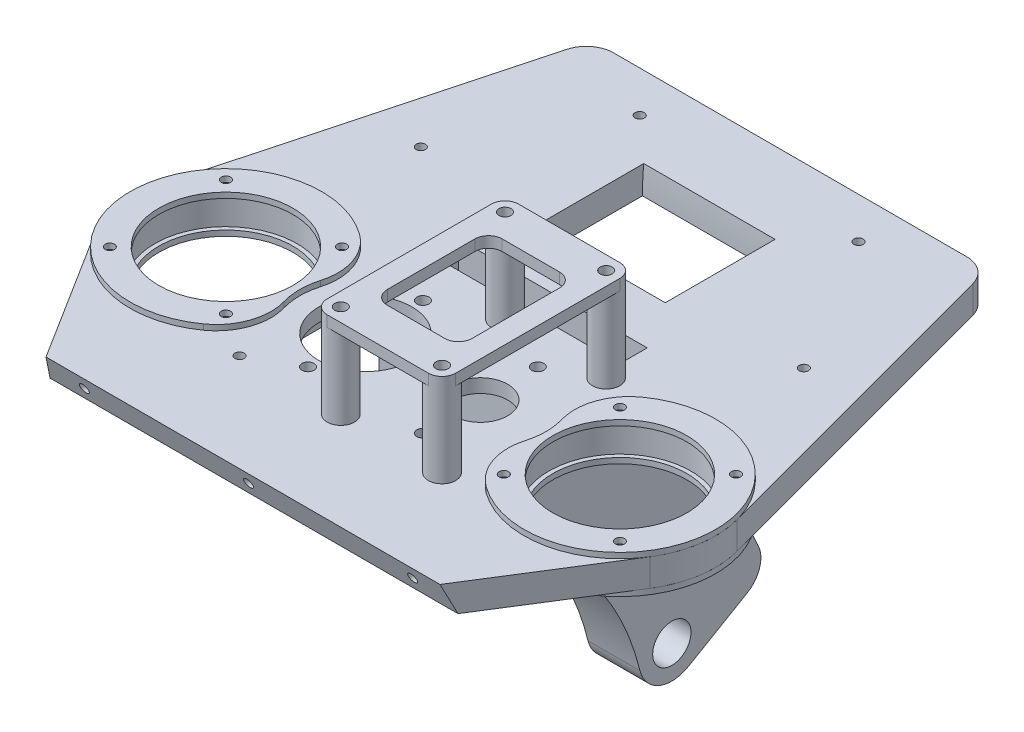
from build123d import *

# Parameters (mm, degrees)
EXTRUDE_1_DEPTH          = 2.5
EXTRUDE_1_DEPTH_BACK     = 2.5
SKETCH_1_R               = 13
SKETCH_1_R_2             = 1.1
SKETCH_1_R_3             = 5
SKETCH_1_R_4             = 8.5
SKETCH_1_R_5             = 0.85
SKETCH_2_R               = 1.1
SKETCH_2_R_2             = 12.25
EXTRUDE_2_DEPTH          = 1
MIRROR_START             = -3.5
MIRROR_1_OUTLINE_R       = 1.1
MIRROR_1_OUTLINE_R_2     = 12.25
MIRROR_1_DEPTH           = 1
MIRROR_START_2           = 2.5
MIRROR_1_2_OUTLINE_R     = 1.1
MIRROR_1_2_OUTLINE_R_2   = 12.25
MIRROR_1_2_DEPTH         = 1
EXTRUDE_START            = -1
SKETCH_38_R              = 1.1
SKETCH_38_R_2            = 0.85
EXTRUDE_10_DEPTH         = 1
SKETCH_3_W               = 36
SKETCH_3_H               = 26
CUT_EXTRUDE_1_DEPTH      = 2.5
SKETCH_6_R               = 1.1
EXTRUDE_3_DEPTH          = 2
SKETCH_16_R              = 3.5
EXTRUDE_6_DEPTH          = 6
EXTRUDE_7_DEPTH          = 33.5
EXTRUDE_7_DEPTH_BACK     = 3
SKETCH_17_R              = 3.5
CUT_EXTRUDE_7_DEPTH      = 12
CUT_EXTRUDE_7_DEPTH_BACK = 12
SKETCH_24_R              = 22.5
CUT_EXTRUDE_8_REACH      = 83.241
CUT_EXTRUDE_8_END_RADIUS = 22.5
SKETCH_25_W              = 34.5
SKETCH_25_H              = 5
CUT_EXTRUDE_9_DEPTH      = 4
CUT_EXTRUDE_9_DEPTH_BACK = 4
SKETCH_26_R              = 77.5
EXTRUDE_8_DEPTH          = 5
SKETCH_28_R              = 72.5
SKETCH_28_R_2            = 52.5
CUT_EXTRUDE_10_DEPTH     = 24
CUT_EXTRUDE_11_DEPTH     = 10
SKETCH_30_R              = 0.85
CUT_EXTRUDE_12_DEPTH     = 10
FILLET_1_R               = 5
SKETCH_31_R              = 0.85
CUT_EXTRUDE_13_DEPTH     = 100.843329311
SKETCH_32_R              = 0.85
CUT_EXTRUDE_14_DEPTH     = 100.843329311
SKETCH_33_W              = 34.5
SKETCH_33_H              = 5
CUT_EXTRUDE_15_DEPTH     = 98.384241066
EXTRUDE_START_2          = -5
EXTRUDE_9_DEPTH          = 5
CUT_EXTRUDE_16_DEPTH     = 133.551651849
CUT_EXTRUDE_START        = -10
SKETCH_36_R              = 0.85
CUT_EXTRUDE_17_DEPTH     = 10
SKETCH_39_R              = 2.5
SKETCH_39_R_2            = 1.1
EXTRUDE_11_DEPTH         = 15
EXTRUDE_11_2_DEPTH       = 15
EXTRUDE_11_3_DEPTH       = 15
EXTRUDE_11_4_DEPTH       = 15
CUT_EXTRUDE_18_DEPTH     = 2


# Read off the part's stored shape, not the designer's step: ﾐﾗｰ1
with BuildPart() as part:
    # ｽｹｯﾁ1 → ﾎﾞｽ - 押し出し1 (new, two sides: drawn at the far end of the back side and taken through both)
    with BuildSketch(Plane(origin=(0, 0, 0), x_dir=(1, 0, 0), z_dir=(0, 1, 0)).offset(-EXTRUDE_1_DEPTH_BACK)):
        with BuildLine():
            Line((-36, 17.5), (36, 17.5))
            ThreePointArc((36, 17.5), (53.5, 0), (36, -17.5))
            Line((36, -17.5), (-36, -17.5))
            ThreePointArc((-36, -17.5), (-53.5, 0), (-36, 17.5))
        make_face()
        with Locations(Location((-36, 0, 0), (0, 0, 270))):
            Circle(SKETCH_1_R, mode=Mode.SUBTRACT)
        with Locations(Location((36, 0, 0), (0, 0, 270))):
            Circle(SKETCH_1_R, mode=Mode.SUBTRACT)
        with Locations(Location((-46.606601718, 10.606601718, 0), (0, 0, 270))):
            Circle(SKETCH_1_R_2, mode=Mode.SUBTRACT)
        with Locations(Location((-25.393398282, 10.606601718, 0), (0, 0, 270))):
            Circle(SKETCH_1_R_2, mode=Mode.SUBTRACT)
        with Locations(Location((-25.393398282, -10.606601718, 0), (0, 0, 270))):
            Circle(SKETCH_1_R_2, mode=Mode.SUBTRACT)
        with Locations(Location((-46.606601718, -10.606601718, 0), (0, 0, 270))):
            Circle(SKETCH_1_R_2, mode=Mode.SUBTRACT)
        with Locations(Location((46.606601718, 10.606601718, 0), (0, 0, 90))):
            Circle(SKETCH_1_R_2, mode=Mode.SUBTRACT)
        with Locations(Location((46.606601718, -10.606601718, 0), (0, 0, 90))):
            Circle(SKETCH_1_R_2, mode=Mode.SUBTRACT)
        with Locations(Location((25.393398282, -10.606601718, 0), (0, 0, 90))):
            Circle(SKETCH_1_R_2, mode=Mode.SUBTRACT)
        with Locations(Location((25.393398282, 10.606601718, 0), (0, 0, 90))):
            Circle(SKETCH_1_R_2, mode=Mode.SUBTRACT)
        with Locations(Location((-10.5, 10.5, 0), (0, 0, 270))):
            Circle(SKETCH_1_R_2, mode=Mode.SUBTRACT)
        with Locations(Location((-10.5, -10.5, 0), (0, 0, 90))):
            Circle(SKETCH_1_R_2, mode=Mode.SUBTRACT)
        with Locations(Location((10.5, -10.5, 0), (0, 0, 270))):
            Circle(SKETCH_1_R_2, mode=Mode.SUBTRACT)
        with Locations(Location((10.5, 10.5, 0), (0, 0, 90))):
            Circle(SKETCH_1_R_2, mode=Mode.SUBTRACT)
        with Locations(Location((10.5, 0, 0), (0, 0, 270))):
            Circle(SKETCH_1_R_3, mode=Mode.SUBTRACT)
        with Locations(Location((-10.5, 0, 0), (0, 0, 270))):
            Circle(SKETCH_1_R_4, mode=Mode.SUBTRACT)
        with Locations(Location((0, 15, 0), (0, 0, 270))):
            Circle(SKETCH_1_R_5, mode=Mode.SUBTRACT)
        with Locations(Location((0, -15, 0), (0, 0, 90))):
            Circle(SKETCH_1_R_5, mode=Mode.SUBTRACT)
        with Locations(Location((18.5, -15, 0), (0, 0, 270))):
            Circle(SKETCH_1_R_5, mode=Mode.SUBTRACT)
        with Locations(Location((18.5, 15, 0), (0, 0, 90))):
            Circle(SKETCH_1_R_5, mode=Mode.SUBTRACT)
        with Locations(Location((-18.5, -15, 0), (0, 0, 90))):
            Circle(SKETCH_1_R_5, mode=Mode.SUBTRACT)
        with Locations(Location((-18.5, 15, 0), (0, 0, 270))):
            Circle(SKETCH_1_R_5, mode=Mode.SUBTRACT)
    extrude(amount=EXTRUDE_1_DEPTH + EXTRUDE_1_DEPTH_BACK)

    # ｽｹｯﾁ3 → ｶｯﾄ - 押し出し1 (cut)
    with BuildSketch(Plane.XZ.offset(2.5)):
        with Locations((-2.5, 0)):
            Rectangle(SKETCH_3_W, SKETCH_3_H)
    extrude(amount=-CUT_EXTRUDE_1_DEPTH, mode=Mode.SUBTRACT)


with BuildPart() as body_2:
    # ｽｹｯﾁ2 → ﾎﾞｽ - 押し出し2 (new body)
    with BuildSketch(Plane(origin=(0, 2.5, 0), x_dir=(1, 0, 0), z_dir=(0, 1, 0))):
        with BuildLine():
            ThreePointArc((-25.820261438, 14.234567883), (-53.5, 0), (-25.820261438, -14.234567883))
            ThreePointArc((-25.820261438, -14.234567883), (-22.191510142, -9.383501212), (-22.029411765, -3.327561323))
            ThreePointArc((-22.029411765, -3.327561323), (-22.5, 0), (-22.029411765, 3.327561323))
            ThreePointArc((-22.029411765, 3.327561323), (-22.191510142, 9.383501212), (-25.820261438, 14.234567883))
        make_face()
        with Locations(Location((-25.393398282, 10.606601718, 0), (0, 0, 270))):
            Circle(SKETCH_2_R, mode=Mode.SUBTRACT)
        with Locations(Location((-25.393398282, -10.606601718, 0), (0, 0, 270))):
            Circle(SKETCH_2_R, mode=Mode.SUBTRACT)
        with Locations(Location((-46.606601718, -10.606601718, 0), (0, 0, 270))):
            Circle(SKETCH_2_R, mode=Mode.SUBTRACT)
        with Locations(Location((-46.606601718, 10.606601718, 0), (0, 0, 270))):
            Circle(SKETCH_2_R, mode=Mode.SUBTRACT)
        with Locations(Location((-36, 0, 0), (0, 0, 270))):
            Circle(SKETCH_2_R_2, mode=Mode.SUBTRACT)
    extrude(amount=EXTRUDE_2_DEPTH)



with BuildPart() as body_3:
    # ﾐﾗｰ1 outline → ﾐﾗｰ1 (new body)
    # profile 1 of 2: a face of its own
    with BuildSketch(Plane(origin=(0, 0, 0), x_dir=(1, 0, 0), z_dir=(0, 1, 0)).offset(MIRROR_START)):
        with BuildLine():
            ThreePointArc((25.820261438, -14.234567883), (53.5, 0), (25.820261438, 14.234567883))
            ThreePointArc((25.820261438, 14.234567883), (22.191510142, 9.383501212), (22.029411765, 3.327561323))
            ThreePointArc((22.029411765, 3.327561323), (22.5, 0), (22.029411765, -3.327561323))
            ThreePointArc((22.029411765, -3.327561323), (22.191510142, -9.383501212), (25.820261438, -14.234567883))
        make_face()
        with Locations((25.393398282, -10.606601718)):
            Circle(MIRROR_1_OUTLINE_R, mode=Mode.SUBTRACT)
        with Locations((46.606601718, -10.606601718)):
            Circle(MIRROR_1_OUTLINE_R, mode=Mode.SUBTRACT)
        with Locations((36, 0)):
            Circle(MIRROR_1_OUTLINE_R_2, mode=Mode.SUBTRACT)
        with Locations((25.393398282, 10.606601718)):
            Circle(MIRROR_1_OUTLINE_R, mode=Mode.SUBTRACT)
        with Locations((46.606601718, 10.606601718)):
            Circle(MIRROR_1_OUTLINE_R, mode=Mode.SUBTRACT)
    # profile 2 of 2: a face of its own
    with BuildSketch(Plane(origin=(0, 0, 0), x_dir=(1, 0, 0), z_dir=(0, 1, 0)).offset(MIRROR_START)):
        with BuildLine():
            ThreePointArc((-22.029411765, -3.327561323), (-22.5, 0), (-22.029411765, 3.327561323))
            ThreePointArc((-22.029411765, 3.327561323), (-22.191510142, 9.383501212), (-25.820261438, 14.234567883))
            ThreePointArc((-25.820261438, 14.234567883), (-53.5, 0), (-25.820261438, -14.234567883))
            ThreePointArc((-25.820261438, -14.234567883), (-22.191510142, -9.383501212), (-22.029411765, -3.327561323))
        make_face()
        with Locations((-46.606601718, -10.606601718)):
            Circle(MIRROR_1_OUTLINE_R, mode=Mode.SUBTRACT)
        with Locations((-25.393398282, -10.606601718)):
            Circle(MIRROR_1_OUTLINE_R, mode=Mode.SUBTRACT)
        with Locations((-36, 0)):
            Circle(MIRROR_1_OUTLINE_R_2, mode=Mode.SUBTRACT)
        with Locations((-46.606601718, 10.606601718)):
            Circle(MIRROR_1_OUTLINE_R, mode=Mode.SUBTRACT)
        with Locations((-25.393398282, 10.606601718)):
            Circle(MIRROR_1_OUTLINE_R, mode=Mode.SUBTRACT)
    extrude(amount=MIRROR_1_DEPTH)


with BuildPart() as body_4:
    # Mirror 1 2 outline → Mirror 1 2 (new body)
    with BuildSketch(Plane(origin=(0, 0, 0), x_dir=(1, 0, 0), z_dir=(0, 1, 0)).offset(MIRROR_START_2)):
        with BuildLine():
            ThreePointArc((25.820261438, -14.234567883), (53.5, 0), (25.820261438, 14.234567883))
            ThreePointArc((25.820261438, 14.234567883), (22.191510142, 9.383501212), (22.029411765, 3.327561323))
            ThreePointArc((22.029411765, 3.327561323), (22.5, 0), (22.029411765, -3.327561323))
            ThreePointArc((22.029411765, -3.327561323), (22.191510142, -9.383501212), (25.820261438, -14.234567883))
        make_face()
        with Locations((25.393398282, -10.606601718)):
            Circle(MIRROR_1_2_OUTLINE_R, mode=Mode.SUBTRACT)
        with Locations((46.606601718, -10.606601718)):
            Circle(MIRROR_1_2_OUTLINE_R, mode=Mode.SUBTRACT)
        with Locations((36, 0)):
            Circle(MIRROR_1_2_OUTLINE_R_2, mode=Mode.SUBTRACT)
        with Locations((25.393398282, 10.606601718)):
            Circle(MIRROR_1_2_OUTLINE_R, mode=Mode.SUBTRACT)
        with Locations((46.606601718, 10.606601718)):
            Circle(MIRROR_1_2_OUTLINE_R, mode=Mode.SUBTRACT)
    extrude(amount=MIRROR_1_2_DEPTH)


with BuildPart() as body_2_1:
    add(body_2.part)

    add(body_4.part)  # ﾎﾞｽ - 押し出し10 merges body 4
    # ｽｹｯﾁ38 → ﾎﾞｽ - 押し出し10 (add)
    # profile 1 of 8: a face of its own
    with BuildSketch(Plane(origin=(0, 3.5, 0), x_dir=(1, 0, 0), z_dir=(0, 1, 0)).offset(EXTRUDE_START)):
        with Locations(Location((46.606601718, -10.606601718, 0), (0, 0, 270))):
            Circle(SKETCH_38_R)
        with Locations(Location((46.606601718, -10.606601718, 0), (0, 0, 270))):
            Circle(SKETCH_38_R_2, mode=Mode.SUBTRACT)
    # profile 2 of 8: a face of its own
    with BuildSketch(Plane(origin=(0, 3.5, 0), x_dir=(1, 0, 0), z_dir=(0, 1, 0)).offset(EXTRUDE_START)):
        with Locations(Location((46.606601718, 10.606601718, 0), (0, 0, 270))):
            Circle(SKETCH_38_R)
        with Locations(Location((46.606601718, 10.606601718, 0), (0, 0, 270))):
            Circle(SKETCH_38_R_2, mode=Mode.SUBTRACT)
    # profile 3 of 8: a face of its own
    with BuildSketch(Plane(origin=(0, 3.5, 0), x_dir=(1, 0, 0), z_dir=(0, 1, 0)).offset(EXTRUDE_START)):
        with Locations(Location((25.393398282, 10.606601718, 0), (0, 0, 270))):
            Circle(SKETCH_38_R)
        with Locations(Location((25.393398282, 10.606601718, 0), (0, 0, 270))):
            Circle(SKETCH_38_R_2, mode=Mode.SUBTRACT)
    # profile 4 of 8: a face of its own
    with BuildSketch(Plane(origin=(0, 3.5, 0), x_dir=(1, 0, 0), z_dir=(0, 1, 0)).offset(EXTRUDE_START)):
        with Locations(Location((25.393398282, -10.606601718, 0), (0, 0, 270))):
            Circle(SKETCH_38_R)
        with Locations(Location((25.393398282, -10.606601718, 0), (0, 0, 270))):
            Circle(SKETCH_38_R_2, mode=Mode.SUBTRACT)
    # profile 5 of 8: a face of its own
    with BuildSketch(Plane(origin=(0, 3.5, 0), x_dir=(1, 0, 0), z_dir=(0, 1, 0)).offset(EXTRUDE_START)):
        with Locations(Location((-25.393398282, 10.606601718, 0), (0, 0, 270))):
            Circle(SKETCH_38_R)
        with Locations(Location((-25.393398282, 10.606601718, 0), (0, 0, 270))):
            Circle(SKETCH_38_R_2, mode=Mode.SUBTRACT)
    # profile 6 of 8: a face of its own
    with BuildSketch(Plane(origin=(0, 3.5, 0), x_dir=(1, 0, 0), z_dir=(0, 1, 0)).offset(EXTRUDE_START)):
        with Locations(Location((-25.393398282, -10.606601718, 0), (0, 0, 270))):
            Circle(SKETCH_38_R)
        with Locations(Location((-25.393398282, -10.606601718, 0), (0, 0, 270))):
            Circle(SKETCH_38_R_2, mode=Mode.SUBTRACT)
    # profile 7 of 8: a face of its own
    with BuildSketch(Plane(origin=(0, 3.5, 0), x_dir=(1, 0, 0), z_dir=(0, 1, 0)).offset(EXTRUDE_START)):
        with Locations(Location((-46.606601718, -10.606601718, 0), (0, 0, 270))):
            Circle(SKETCH_38_R)
        with Locations(Location((-46.606601718, -10.606601718, 0), (0, 0, 270))):
            Circle(SKETCH_38_R_2, mode=Mode.SUBTRACT)
    # profile 8 of 8: a face of its own
    with BuildSketch(Plane(origin=(0, 3.5, 0), x_dir=(1, 0, 0), z_dir=(0, 1, 0)).offset(EXTRUDE_START)):
        with Locations(Location((-46.606601718, 10.606601718, 0), (0, 0, 270))):
            Circle(SKETCH_38_R)
        with Locations(Location((-46.606601718, 10.606601718, 0), (0, 0, 270))):
            Circle(SKETCH_38_R_2, mode=Mode.SUBTRACT)
    extrude(amount=EXTRUDE_10_DEPTH)


with BuildPart() as body_4_2:
    # ｽｹｯﾁ6 → ﾎﾞｽ - 押し出し3 (new body)
    with BuildSketch(Plane(origin=(0, 17.5, 0), x_dir=(1, 0, 0), z_dir=(0, 1, 0))):
        with BuildLine():
            Line((-2.5, -15), (-2.5, 15))
            ThreePointArc((-2.5, 15), (-1.767766953, 16.767766953), (0, 17.5))
            Line((0, 17.5), (18.5, 17.5))
            ThreePointArc((18.5, 17.5), (20.267766953, 16.767766953), (21, 15))
            Line((21, 15), (21, -15))
            ThreePointArc((21, -15), (20.267766953, -16.767766953), (18.5, -17.5))
            Line((18.5, -17.5), (0, -17.5))
            ThreePointArc((0, -17.5), (-1.767766953, -16.767766953), (-2.5, -15))
        make_face()
        with Locations(Location((18.5, 15, 0), (0, 0, 270))):
            Circle(SKETCH_6_R, mode=Mode.SUBTRACT)
        with Locations(Location((18.5, -15, 0), (0, 0, 270))):
            Circle(SKETCH_6_R, mode=Mode.SUBTRACT)
        with Locations(Location((0, -15, 0), (0, 0, 270))):
            Circle(SKETCH_6_R, mode=Mode.SUBTRACT)
        with Locations(Location((0, 15, 0), (0, 0, 270))):
            Circle(SKETCH_6_R, mode=Mode.SUBTRACT)
    extrude(amount=EXTRUDE_3_DEPTH)

    # ｽｹｯﾁ40 → ｶｯﾄ - 押し出し18 (cut)
    with BuildSketch(Plane(origin=(0, 19.5, 0), x_dir=(1, 0, 0), z_dir=(0, 1, 0))):
        with BuildLine():
            Line((14.5, 10.5), (4, 10.5))
            ThreePointArc((4, 10.5), (2.232233047, 9.767766953), (1.5, 8))
            Line((1.5, 8), (1.5, -8))
            ThreePointArc((1.5, -8), (2.232233047, -9.767766953), (4, -10.5))
            Line((4, -10.5), (14.5, -10.5))
            ThreePointArc((14.5, -10.5), (16.267766953, -9.767766953), (17, -8))
            Line((17, -8), (17, 8))
            ThreePointArc((17, 8), (16.267766953, 9.767766953), (14.5, 10.5))
        make_face()
    extrude(amount=-CUT_EXTRUDE_18_DEPTH, mode=Mode.SUBTRACT)


with BuildPart() as body_5:
    # ｽｹｯﾁ16 → ﾎﾞｽ - 押し出し6 (new body)
    with BuildSketch(Plane.ZY.offset(-15.5)):
        with BuildLine():
            Line((-17.5, -2.5), (17.5, -2.5))
            Line((17.5, -2.5), (17.5, -6.361311567))
            ThreePointArc((17.5, -6.361311567), (17.199778308, -7.261607081), (16.41929065, -7.801518272))
            ThreePointArc((16.41929065, -7.801518272), (-5.717751854, -21.227741547), (-18.171895109, -43.925900901))
            ThreePointArc((-18.171895109, -43.925900901), (-21.653600917, -48.022174512), (-27.019056708, -47.685103335))
            Line((-27.019056708, -47.685103335), (-37.787855918, -41.414907083))
            ThreePointArc((-37.787855918, -41.414907083), (-40.062610236, -38.525705895), (-39.746207725, -34.862117467))
            ThreePointArc((-39.746207725, -34.862117467), (-34.627518489, -21.392901217), (-32.273619314, -7.177419355))
            ThreePointArc((-32.273619314, -7.177419355), (-30.703619064, -3.852199072), (-27.284035992, -2.5))
            Line((-27.284035992, -2.5), (-17.5, -2.5))
        make_face()
        with Locations((-24, -42.5)):
            Circle(SKETCH_16_R, mode=Mode.SUBTRACT)
    extrude(amount=-EXTRUDE_6_DEPTH)

    # ｽｹｯﾁ17 → ﾎﾞｽ - 押し出し7 (add, two sides: drawn at the far end of the back side and taken through both)
    with BuildSketch(Plane(origin=(-18, 0, 0), x_dir=(0, 0, -1), z_dir=(1, 0, 0)).offset(-EXTRUDE_7_DEPTH_BACK)):
        with BuildLine():
            Line((13, -2.5), (13, -28.442279242))
            ThreePointArc((13, -28.442279242), (13.279075591, -30.78826062), (14.100725725, -33.00330077))
            ThreePointArc((14.100725725, -33.00330077), (16.455701543, -38.345554514), (18.171895109, -43.925900901))
            ThreePointArc((18.171895109, -43.925900901), (21.653600917, -48.022174512), (27.019056708, -47.685103335))
            Line((27.019056708, -47.685103335), (37.787855918, -41.414907083))
            ThreePointArc((37.787855918, -41.414907083), (40.062610236, -38.525705895), (39.746207725, -34.862117467))
            ThreePointArc((39.746207725, -34.862117467), (34.627518489, -21.392901217), (32.273619314, -7.177419355))
            ThreePointArc((32.273619314, -7.177419355), (30.703619064, -3.852199072), (27.284035992, -2.5))
            Line((27.284035992, -2.5), (13, -2.5))
        make_face()
        with Locations(Location((24, -42.5, 0), (0, 0, 180))):
            Circle(SKETCH_17_R, mode=Mode.SUBTRACT)
    extrude(amount=EXTRUDE_7_DEPTH + EXTRUDE_7_DEPTH_BACK)

    # ｽｹｯﾁ24 → ｶｯﾄ - 押し出し7 (cut, two sides: drawn at the far end of the back side and taken through both)
    with BuildSketch(Plane(origin=(0, 0, 0), x_dir=(0, 0, -1), z_dir=(1, 0, 0)).offset(-CUT_EXTRUDE_7_DEPTH_BACK)):
        with Locations((24, -42.5)):
            Circle(SKETCH_24_R)
    extrude(amount=CUT_EXTRUDE_7_DEPTH + CUT_EXTRUDE_7_DEPTH_BACK, mode=Mode.SUBTRACT)

    # ｶｯﾄ - 押し出し8: up to this cylinder (the profile starts outside it)
    cut_extrude_8_end = Plane(origin=(0.25, -42.5, -24), z_dir=(-1, 0, 0)) * Cylinder(CUT_EXTRUDE_8_END_RADIUS, 212.482, mode=Mode.PRIVATE)
    # ｽｹｯﾁ25 → ｶｯﾄ - 押し出し8 (cut, up to the surface)
    with BuildSketch(Plane(origin=(0, -2.5, 0), x_dir=(1, 0, 0), z_dir=(0, 1, 0)), mode=Mode.PRIVATE) as cut_extrude_8_sk1:
        with Locations((0.25, 21)):
            Rectangle(SKETCH_25_W, SKETCH_25_H)
    cut_extrude_8_tool1 = extrude(cut_extrude_8_sk1.sketch, amount=-CUT_EXTRUDE_8_REACH, mode=Mode.PRIVATE) - cut_extrude_8_end
    add(cut_extrude_8_tool1.solids().sort_by_distance((0.25, -2.5, -21))[0], mode=Mode.SUBTRACT)

    # ｽｹｯﾁ26 → ｶｯﾄ - 押し出し9 (cut, two sides: drawn at the far end of the back side and taken through both)
    with BuildSketch(Plane(origin=(0, 0, 0), x_dir=(0, 0, -1), z_dir=(1, 0, 0)).offset(-CUT_EXTRUDE_9_DEPTH_BACK)):
        with Locations((104.622577483, -2.5)):
            Circle(SKETCH_26_R)
    extrude(amount=CUT_EXTRUDE_9_DEPTH + CUT_EXTRUDE_9_DEPTH_BACK, mode=Mode.SUBTRACT)


with BuildPart() as body_6:
    # ｽｹｯﾁ27 → ﾎﾞｽ - 押し出し8 (new body)
    with BuildSketch(Plane(origin=(0, 2.5, 0), x_dir=(1, 0, 0), z_dir=(0, 1, 0))):
        with BuildLine():
            Line((52.901635865, 4.537037037), (36, 67.5))
            Line((36, 67.5), (-36, 67.5))
            Line((-36, 67.5), (-52.901635865, 4.537037037))
            ThreePointArc((-52.901635865, 4.537037037), (-46.65016084, 13.886110833), (-36, 17.5))
            Line((-36, 17.5), (36, 17.5))
            ThreePointArc((36, 17.5), (46.65016084, 13.886110833), (52.901635865, 4.537037037))
        make_face()
    extrude(amount=-EXTRUDE_8_DEPTH)

    # ｽｹｯﾁ28 → ｶｯﾄ - 押し出し10 (cut)
    with BuildSketch(Plane.ZY.offset(-12)):
        with Locations((-104.622577483, -2.5)):
            Circle(SKETCH_28_R)
        with Locations((-104.622577483, -2.5)):
            Circle(SKETCH_28_R_2, mode=Mode.SUBTRACT)
    extrude(amount=CUT_EXTRUDE_10_DEPTH, mode=Mode.SUBTRACT)


with BuildPart() as part_1:
    add(part.part)

    # Combine 2: union body 6
    add(body_6.part)

    # ｽｹｯﾁ29 → ｶｯﾄ - 押し出し11 (cut)
    with BuildSketch(Plane(origin=(0, 2.5, 0), x_dir=(1, 0, 0), z_dir=(0, 1, 0))):
        Polygon((-36.10131445, 67.122577483), (36.10131445, 67.122577483), (36, 67.5), (-36, 67.5), align=None)
    extrude(amount=-CUT_EXTRUDE_11_DEPTH, mode=Mode.SUBTRACT)

    # ｽｹｯﾁ30 → ｶｯﾄ - 押し出し12 (cut)
    with BuildSketch(Plane(origin=(0, 0, -67.122577483), x_dir=(-1, 0, 0), z_dir=(0, 0, -1))):
        with Locations((-30, 0)):
            Circle(SKETCH_30_R)
        with Locations((30, 0)):
            Circle(SKETCH_30_R)
        Circle(SKETCH_30_R)
    extrude(amount=-CUT_EXTRUDE_12_DEPTH, mode=Mode.SUBTRACT)

    # ﾌｨﾚｯﾄ1
    fillet_1_edges = [part_1.edges().sort_by_distance(p)[0] for p in [
        (36.10131445, 0, -67.122577483),
        (-36.10131445, 0, -67.122577483),
    ]]
    fillet(fillet_1_edges, radius=FILLET_1_R)

    # ｽｹｯﾁ31 → ｶｯﾄ - 押し出し13 (cut, through all)
    with BuildSketch(Plane(origin=(0, 2.5, 0), x_dir=(1, 0, 0), z_dir=(0, 1, 0))):
        with Locations(Location((20, 59.622577483, 0), (0, 0, 270))):
            Circle(SKETCH_31_R)
        with Locations(Location((-20, 59.622577483, 0), (0, 0, 270))):
            Circle(SKETCH_31_R)
    extrude(amount=-CUT_EXTRUDE_13_DEPTH, mode=Mode.SUBTRACT)

    # ｽｹｯﾁ32 → ｶｯﾄ - 押し出し14 (cut, through all)
    with BuildSketch(Plane(origin=(0, 2.5, 0), x_dir=(1, 0, 0), z_dir=(0, 1, 0))):
        with Locations(Location((-35, 34.622577483, 0), (0, 0, 270))):
            Circle(SKETCH_32_R)
        with Locations(Location((35, 34.622577483, 0), (0, 0, 270))):
            Circle(SKETCH_32_R)
    extrude(amount=-CUT_EXTRUDE_14_DEPTH, mode=Mode.SUBTRACT)

    # ｽｹｯﾁ33 → ｶｯﾄ - 押し出し15 (cut, through all)
    with BuildSketch(Plane.XZ.offset(2.5)):
        with Locations((0.25, -21)):
            Rectangle(SKETCH_33_W, SKETCH_33_H)
    extrude(amount=-CUT_EXTRUDE_15_DEPTH, mode=Mode.SUBTRACT)

    # ｽｹｯﾁ34 → ﾎﾞｽ - 押し出し9 (add)
    with BuildSketch(Plane(origin=(0, 2.5, 0), x_dir=(1, 0, 0), z_dir=(0, 1, 0)).offset(EXTRUDE_START_2)):
        with BuildLine():
            ThreePointArc((-36, -17.5), (-44.462836356, -15.317649977), (-50.814944584, -9.31490295))
            Line((-50.814944584, -9.31490295), (-36, -32.877422517))
            Line((-36, -32.877422517), (36, -32.877422517))
            Line((36, -32.877422517), (50.814944584, -9.31490295))
            ThreePointArc((50.814944584, -9.31490295), (44.462836356, -15.317649977), (36, -17.5))
            Line((36, -17.5), (-36, -17.5))
        make_face()
    extrude(amount=EXTRUDE_9_DEPTH)

    # ｽｹｯﾁ35 → ｶｯﾄ - 押し出し16 (cut, through all)
    with BuildSketch(Plane(origin=(-50, 0, 0), x_dir=(0, 0, -1), z_dir=(1, 0, 0))):
        Polygon((-32.877422517, 2.5), (-32.877422517, -2.5), (-30.857291388, -2.5), align=None)
    extrude(amount=CUT_EXTRUDE_16_DEPTH, mode=Mode.SUBTRACT)

    # ｽｹｯﾁ36 → ｶｯﾄ - 押し出し17 (cut)
    with BuildSketch(Plane.XY.offset(32.877422517).offset(CUT_EXTRUDE_START)):
        with Locations(Location((0, 0, 0), (0, 0, 180))):
            Circle(SKETCH_36_R)
        with Locations(Location((-30, 0, 0), (0, 0, 180))):
            Circle(SKETCH_36_R)
        with Locations(Location((30, 0, 0), (0, 0, 180))):
            Circle(SKETCH_36_R)
    extrude(amount=CUT_EXTRUDE_17_DEPTH, mode=Mode.SUBTRACT)


with BuildPart() as body_6_2:
    # ｽｹｯﾁ39 → ﾎﾞｽ - 押し出し11 (new body)
    with BuildSketch(Plane(origin=(0, 2.5, 0), x_dir=(1, 0, 0), z_dir=(0, 1, 0))):
        with Locations(Location((0, -15, 0), (0, 0, 90))):
            Circle(SKETCH_39_R)
        with Locations(Location((0, -15, 0), (0, 0, 90))):
            Circle(SKETCH_39_R_2, mode=Mode.SUBTRACT)
    extrude(amount=EXTRUDE_11_DEPTH)


with BuildPart() as body_7:
    # ｽｹｯﾁ39 → Extrude 11 2 (new body)
    with BuildSketch(Plane(origin=(0, 2.5, 0), x_dir=(1, 0, 0), z_dir=(0, 1, 0))):
        with Locations(Location((18.5, -15, 0), (0, 0, 90))):
            Circle(SKETCH_39_R)
        with Locations(Location((18.5, -15, 0), (0, 0, 90))):
            Circle(SKETCH_39_R_2, mode=Mode.SUBTRACT)
    extrude(amount=EXTRUDE_11_2_DEPTH)


with BuildPart() as body_8:
    # ｽｹｯﾁ39 → Extrude 11 3 (new body)
    with BuildSketch(Plane(origin=(0, 2.5, 0), x_dir=(1, 0, 0), z_dir=(0, 1, 0))):
        with Locations(Location((18.5, 15, 0), (0, 0, 90))):
            Circle(SKETCH_39_R)
        with Locations(Location((18.5, 15, 0), (0, 0, 90))):
            Circle(SKETCH_39_R_2, mode=Mode.SUBTRACT)
    extrude(amount=EXTRUDE_11_3_DEPTH)


with BuildPart() as body_9:
    # ｽｹｯﾁ39 → Extrude 11 4 (new body)
    with BuildSketch(Plane(origin=(0, 2.5, 0), x_dir=(1, 0, 0), z_dir=(0, 1, 0))):
        with Locations(Location((0, 15, 0), (0, 0, 90))):
            Circle(SKETCH_39_R)
        with Locations(Location((0, 15, 0), (0, 0, 90))):
            Circle(SKETCH_39_R_2, mode=Mode.SUBTRACT)
    extrude(amount=EXTRUDE_11_4_DEPTH)


with BuildPart() as body_4_2_1:
    add(body_4_2.part)

    # Combine 3: union body 6 2, body 7, body 8, body 9
    add(body_6_2.part)
    add(body_7.part)
    add(body_8.part)
    add(body_9.part)


solid = Compound([body_3.part, body_2_1.part, body_5.part, part_1.part, body_4_2_1.part])
